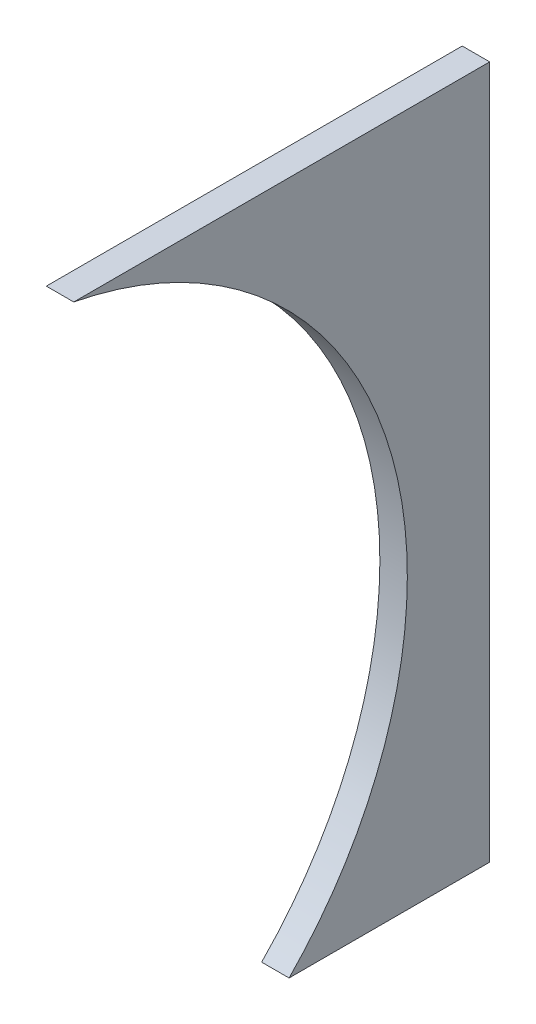
from build123d import *

# Parameters (mm, degrees)
SKETCH1_W           = 228.6
SKETCH1_H           = 320.622631412
BOSS_EXTRUDE1_DEPTH = 12.7
SKETCH2_R           = 190.5
CUT_EXTRUDE1_DEPTH  = 231.051481511


with BuildPart() as part:
    # Sketch1 → Boss-Extrude1 (new body)
    with BuildSketch(Plane(origin=(0, 0, 0), x_dir=(0, 0, -1), z_dir=(1, 0, 0))):
        with Locations((19.05, 26.718552618)):
            Rectangle(SKETCH1_W, SKETCH1_H)
    extrude(amount=BOSS_EXTRUDE1_DEPTH)

    # Sketch2 → Cut-Extrude1 (cut, through all)
    with BuildSketch(Plane(origin=(12.7, 0, 0), x_dir=(0, 0, -1), z_dir=(1, 0, 0))):
        with Locations((-95.25, 0)):
            Circle(SKETCH2_R)
    extrude(amount=-CUT_EXTRUDE1_DEPTH, mode=Mode.SUBTRACT)


solid = part.part
